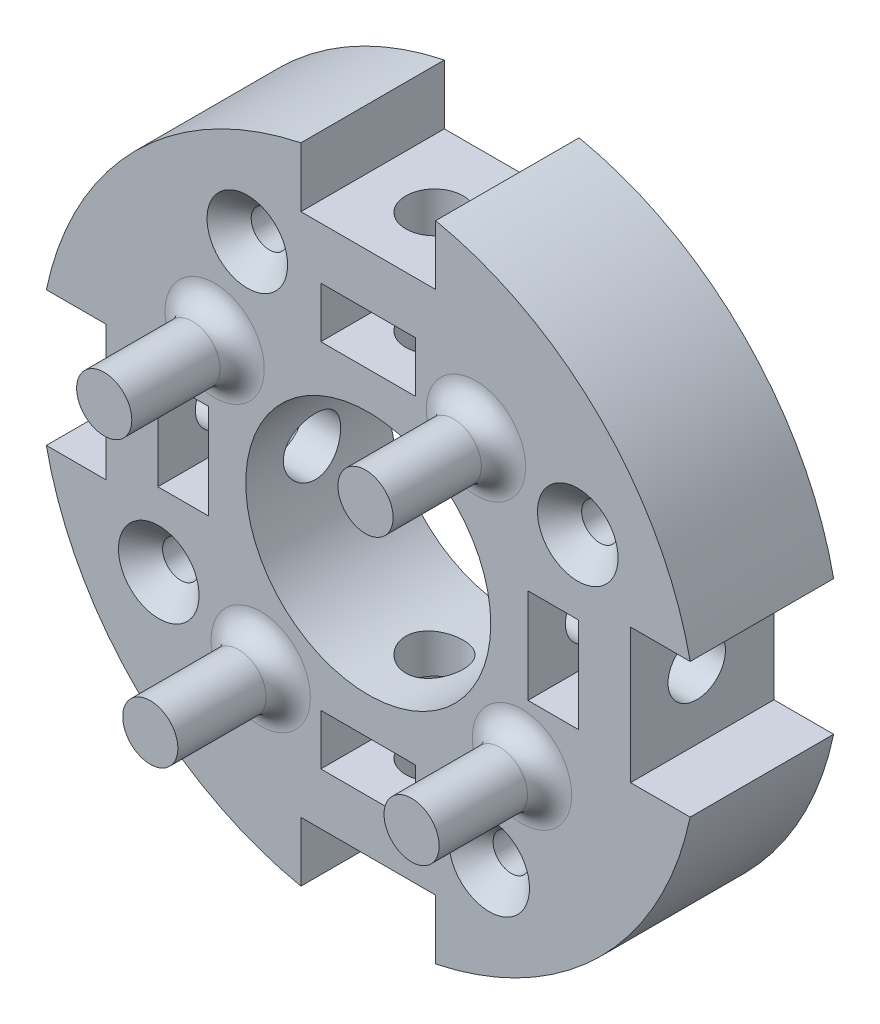
from build123d import *

# Parameters (mm, degrees)
ESQUISSE1_R                  = 1.65
ESQUISSE1_W                  = 4.6
ESQUISSE1_H                  = 8.6
ESQUISSE1_W_2                = 8.6
ESQUISSE1_H_2                = 4.6
ESQUISSE1_R_2                = 11.1
BOSS_EXTRU_1_DEPTH           = 13
CHANFREIN1_SIZE              = 2
ESQUISSE6_R                  = 2.6
ENL_V_MAT_EXTRU_4_DEPTH      = 17
R_P_TITION_CIRCULAIRE1_COUNT = 4
ESQUISSE7_R                  = 2.5
BOSS_EXTRU_2_DEPTH           = 10
CONG_1_R                     = 2


with BuildPart() as part:
    # Esquisse1 → Boss.-Extru.1 (new body)
    with BuildSketch(Plane.XY):
        with BuildLine():
            Line((-6.105930323, 23.762922109), (-6.105930323, 29.167749568))
            ThreePointArc((-6.105930323, 29.167749568), (-21.071782079, 21.071782079), (-29.167749568, 6.105930323))
            Line((-29.167749568, 6.105930323), (-23.762922109, 6.105930323))
            Line((-23.762922109, 6.105930323), (-23.762922109, -6.105930323))
            Line((-23.762922109, -6.105930323), (-29.167749568, -6.105930323))
            ThreePointArc((-29.167749568, -6.105930323), (-21.071782079, -21.071782079), (-6.105930323, -29.167749568))
            Line((-6.105930323, -29.167749568), (-6.105930323, -23.762922109))
            Line((-6.105930323, -23.762922109), (6.105930323, -23.762922109))
            Line((6.105930323, -23.762922109), (6.105930323, -29.167749568))
            ThreePointArc((6.105930323, -29.167749568), (21.071782079, -21.071782079), (29.167749568, -6.105930323))
            Line((29.167749568, -6.105930323), (23.762922109, -6.105930323))
            Line((23.762922109, -6.105930323), (23.762922109, 6.105930323))
            Line((23.762922109, 6.105930323), (29.167749568, 6.105930323))
            ThreePointArc((29.167749568, 6.105930323), (21.071782079, 21.071782079), (6.105930323, 29.167749568))
            Line((6.105930323, 29.167749568), (6.105930323, 23.762922109))
            Line((6.105930323, 23.762922109), (-6.105930323, 23.762922109))
        make_face()
        with Locations((-18.983545507, -10.960155108)):
            Circle(ESQUISSE1_R, mode=Mode.SUBTRACT)
        with Locations((-16.762922109, 0)):
            Rectangle(ESQUISSE1_W, ESQUISSE1_H, mode=Mode.SUBTRACT)
        with Locations((0, -16.762922109)):
            Rectangle(ESQUISSE1_W_2, ESQUISSE1_H_2, mode=Mode.SUBTRACT)
        with Locations((10.960155108, -18.983545507)):
            Circle(ESQUISSE1_R, mode=Mode.SUBTRACT)
        with Locations((-10.960155108, 18.983545507)):
            Circle(ESQUISSE1_R, mode=Mode.SUBTRACT)
        Circle(ESQUISSE1_R_2, mode=Mode.SUBTRACT)
        with Locations((16.762922109, 0)):
            Rectangle(ESQUISSE1_W, ESQUISSE1_H, mode=Mode.SUBTRACT)
        with Locations((18.983545507, 10.960155108)):
            Circle(ESQUISSE1_R, mode=Mode.SUBTRACT)
        with Locations((0, 16.762922109)):
            Rectangle(ESQUISSE1_W_2, ESQUISSE1_H_2, mode=Mode.SUBTRACT)
    extrude(amount=BOSS_EXTRU_1_DEPTH)

    # Chanfrein1
    chanfrein1_edges = [part.edges().sort_by_distance(p)[0] for p in [
        (-20.633545507, -10.960155108, 13),
        (9.310155108, -18.983545507, 13),
        (17.333545507, 10.960155108, 13),
        (-12.610155108, 18.983545507, 13),
    ]]
    chamfer(chanfrein1_edges, length=CHANFREIN1_SIZE)

    # Esquisse6 → Enlèv. mat.-Extru.4 (cut)
    with BuildSketch(Plane.ZY.offset(23.762922109)):
        with Locations((7, 0)):
            Circle(ESQUISSE6_R)
    enl_v_mat_extru_4 = extrude(amount=-ENL_V_MAT_EXTRU_4_DEPTH, mode=Mode.SUBTRACT)

    # Répétition circulaire1: Enlèv. mat.-Extru.4 ×4 about axis
    r_p_tition_circulaire1_axis = Axis((0, 0, 0), (0, 0, 1))
    for i in range(1, R_P_TITION_CIRCULAIRE1_COUNT):
        add(enl_v_mat_extru_4.rotate(r_p_tition_circulaire1_axis, i * 360 / R_P_TITION_CIRCULAIRE1_COUNT), mode=Mode.SUBTRACT)

    # Esquisse7 → Boss.-Extru.2 (add)
    with BuildSketch(Plane.XY.offset(13)):
        with Locations((-13.925584753, 9.750799418)):
            Circle(ESQUISSE7_R)
        with Locations((9.750799418, 13.925584753)):
            Circle(ESQUISSE7_R)
        with Locations((13.925584753, -9.750799418)):
            Circle(ESQUISSE7_R)
        with Locations((-9.750799418, -13.925584753)):
            Circle(ESQUISSE7_R)
    extrude(amount=BOSS_EXTRU_2_DEPTH)

    # Congé1
    cong_1_edges = [part.edges().sort_by_distance(p)[0] for p in [
        (11.425584753, -9.750799418, 13),
        (7.250799418, 13.925584753, 13),
        (-16.425584753, 9.750799418, 13),
        (-12.250799418, -13.925584753, 13),
    ]]
    fillet(cong_1_edges, radius=CONG_1_R)


solid = part.part
